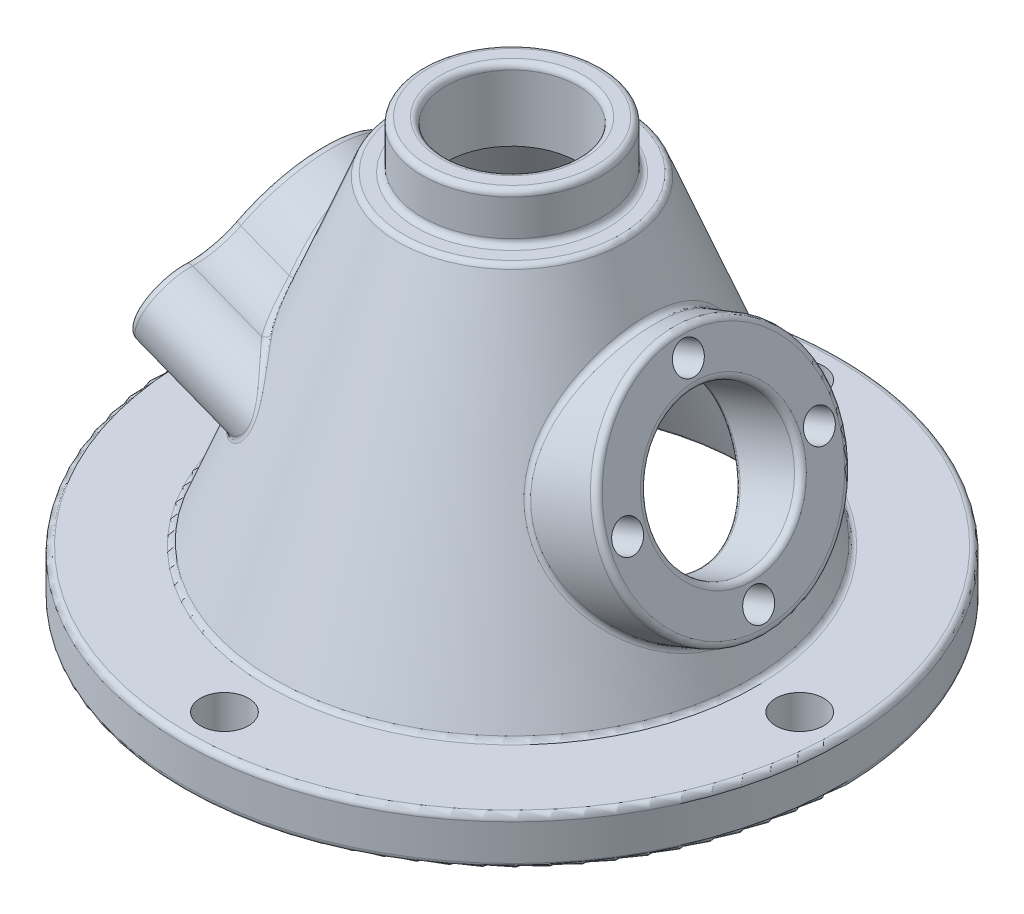
from build123d import *

# Parameters (mm, degrees)
SKETCH1_R                  = 27.499999999999996
SKETCH1_R_2                = 20
SKETCH1_R_3                = 2.0000000000000004
BOSS_EXTRUDE1_DEPTH        = 4
BOSS_EXTRUDE2_REACH        = 64.546
SKETCH9_R                  = 1.2499999999999991
SKETCH9_R_2                = 7.000000000000002
CUT_EXTRUDE1_REACH         = 64.546
SKETCH9_2_R                = 7.000000000000002
SKETCH9_2_R_2              = 1.2499999999999991
BOSS_EXTRUDE3_REACH        = 63.977
SKETCH10_R                 = 10
SKETCH10_R_2               = 6
F_2_5MM_DOWEL_HOLE1_REACH  = 63.977
F_2_5MM_DOWEL_HOLE1_BORE_R = 1.25
CUT_EXTRUDE2_REACH         = 63.977
FILLET1_R                  = 0.5


# Read off the part's stored shape, not the designer's step: Revolve1
with BuildPart() as part:
    # Sketch1 → Boss-Extrude1 (new body)
    with BuildSketch(Plane(origin=(0, 0, 0), x_dir=(1, 0, 0), z_dir=(0, 1, 0))):
        with Locations(Location((0, 0, 0), (0, 0, 270))):
            Circle(SKETCH1_R)
        with Locations(Location((0, 0, 0), (0, 0, 270))):
            Circle(SKETCH1_R_2, mode=Mode.SUBTRACT)
        with Locations(Location((0, 24.000000000000004, 0), (0, 0, 270))):
            Circle(SKETCH1_R_3, mode=Mode.SUBTRACT)
        with Locations(Location((24.000000000000004, -8.38e-14, 0), (0, 0, 270))):
            Circle(SKETCH1_R_3, mode=Mode.SUBTRACT)
        with Locations(Location((-1.6759e-13, -24.000000000000004, 0), (0, 0, 270))):
            Circle(SKETCH1_R_3, mode=Mode.SUBTRACT)
        with Locations(Location((-24, 2.5139e-13, 0), (0, 0, 270))):
            Circle(SKETCH1_R_3, mode=Mode.SUBTRACT)
    extrude(amount=BOSS_EXTRUDE1_DEPTH)

    # Revolve1 outline → Revolve1 (revolve)
    with BuildSketch(Plane.XY):
        Polygon((7.5, 35), (5.5, 35), (5.5, 29), (8.002665629, 29), (19.426069421, 0), (20, 0), (20, 4), (9.364417158, 31), (7.5, 31), align=None)
    revolve(axis=Axis((0, 0, 0), (0, 1, 0)))

    # Sketch9 → Boss-Extrude2 (add, up to next)
    with BuildSketch(Plane(origin=(-22.09393297288762, 8.614064510607436, 0), x_dir=(0.3632512304729791, 0.9316912275855487, 0), z_dir=(0.9316912275855487, -0.3632512304729791, 0)), mode=Mode.PRIVATE) as boss_extrude2_sk1:
        with BuildLine():
            ThreePointArc((14.77259875022217, -6.38125), (17.94769994946997, 0), (14.77259875022217, 6.38125))
            ThreePointArc((14.77259875022217, 6.38125), (13.552789514195275, 7.896554971385807), (13.192028453424037, 9.808081896551725))
            ThreePointArc((13.192028453424037, 9.808081896551725), (9.94769994946997, 13.25), (6.703371445515905, 9.808081896551725))
            ThreePointArc((6.703371445515905, 9.808081896551725), (6.342610384744666, 7.896554971385807), (5.122801148717772, 6.38125))
            ThreePointArc((5.122801148717772, 6.38125), (1.9476999494699712, 9.8e-16), (5.122801148717772, -6.38125))
            ThreePointArc((5.122801148717772, -6.38125), (6.342610384744666, -7.896554971385807), (6.703371445515905, -9.808081896551725))
            ThreePointArc((6.703371445515905, -9.808081896551725), (9.947699949469971, -13.250000000000002), (13.192028453424037, -9.808081896551725))
            ThreePointArc((13.192028453424037, -9.808081896551725), (13.552789514195275, -7.896554971385807), (14.77259875022217, -6.38125))
        make_face()
        with Locations(Location((9.947699949469971, -10, 0), (0, 0, 208.325415901))):
            Circle(SKETCH9_R, mode=Mode.SUBTRACT)
        with Locations(Location((9.94769994946997, 10, 0), (0, 0, 224.865925471))):
            Circle(SKETCH9_R, mode=Mode.SUBTRACT)
        with Locations(Location((9.947699949469971, 0, 0), (0, 0, 200.611127759))):
            Circle(SKETCH9_R_2, mode=Mode.SUBTRACT)
    boss_extrude2_tool1 = extrude(boss_extrude2_sk1.sketch, amount=BOSS_EXTRUDE2_REACH, mode=Mode.PRIVATE) - part.part
    add(boss_extrude2_tool1.solids().sort_by_distance((-18.480419, 17.882249, -12.940444))[0])

    # Sketch9<2> → Cut-Extrude1 (cut, up to next)
    with BuildSketch(Plane(origin=(-22.09393297288762, 8.614064510607436, 0), x_dir=(0.3632512304729791, 0.9316912275855487, 0), z_dir=(0.9316912275855487, -0.3632512304729791, 0)), mode=Mode.PRIVATE) as cut_extrude1_sk1:
        with Locations(Location((9.947699949469971, 0, 0), (0, 0, 189.221872135))):
            Circle(SKETCH9_2_R)
    cut_extrude1_tool1 = extrude(cut_extrude1_sk1.sketch, amount=CUT_EXTRUDE1_REACH, mode=Mode.PRIVATE) & part.part
    # Sketch9<2> → Cut-Extrude1 (cut, up to next)
    with BuildSketch(Plane(origin=(-22.09393297288762, 8.614064510607436, 0), x_dir=(0.3632512304729791, 0.9316912275855487, 0), z_dir=(0.9316912275855487, -0.3632512304729791, 0)), mode=Mode.PRIVATE) as cut_extrude1_sk2:
        with Locations(Location((9.947699949469971, -10, 0), (0, 0, 194.288456843))):
            Circle(SKETCH9_2_R_2)
    cut_extrude1_tool2 = extrude(cut_extrude1_sk2.sketch, amount=CUT_EXTRUDE1_REACH, mode=Mode.PRIVATE) & part.part
    # Sketch9<2> → Cut-Extrude1 (cut, up to next)
    with BuildSketch(Plane(origin=(-22.09393297288762, 8.614064510607436, 0), x_dir=(0.3632512304729791, 0.9316912275855487, 0), z_dir=(0.9316912275855487, -0.3632512304729791, 0)), mode=Mode.PRIVATE) as cut_extrude1_sk3:
        with Locations(Location((9.94769994946997, 10, 0), (0, 0, 227.545772994))):
            Circle(SKETCH9_2_R_2)
    cut_extrude1_tool3 = extrude(cut_extrude1_sk3.sketch, amount=CUT_EXTRUDE1_REACH, mode=Mode.PRIVATE) & part.part
    add(cut_extrude1_tool1.solids().sort_by_distance((-18.480419, 17.882249, 0))[0], mode=Mode.SUBTRACT)
    add(cut_extrude1_tool2.solids().sort_by_distance((-18.480419, 17.882249, -10))[0], mode=Mode.SUBTRACT)
    add(cut_extrude1_tool3.solids().sort_by_distance((-18.480419, 17.882249, 10))[0], mode=Mode.SUBTRACT)

    # Sketch10 → Boss-Extrude3 (add, up to next)
    with BuildSketch(Plane(origin=(21.239146980913837, 8.36632248890728, 0), x_dir=(0.36650122672429136, -0.9304175679820269, 0), z_dir=(-0.9304175679820269, -0.36650122672429136, 0)), mode=Mode.PRIVATE) as boss_extrude3_sk1:
        with Locations(Location((-9.81585567893876, -2.43e-15, 0), (0, 0, 301.3729923))):
            Circle(SKETCH10_R)
        with Locations(Location((-9.81585567893876, -2.43e-15, 0), (0, 0, 333.127229573))):
            Circle(SKETCH10_R_2, mode=Mode.SUBTRACT)
    boss_extrude3_tool1 = extrude(boss_extrude3_sk1.sketch, amount=BOSS_EXTRUDE3_REACH, mode=Mode.PRIVATE) - part.part
    add(boss_extrude3_tool1.solids().sort_by_distance((15.787559, 22.205984, 8.296473))[0])

    # Ø2.5mm Dowel Hole1 bore → Ø2.5mm Dowel Hole1 (cut, up to next)
    with BuildSketch(Plane(origin=(21.23914698091384, 8.366322488907281, 0), x_dir=(0, 0, -1), z_dir=(0.9304175679820269, 0.3665012267242914, 0)), mode=Mode.PRIVATE) as f_2_5mm_dowel_hole1_sk1:
        with Locations((-8, 9.815855679)):
            Circle(F_2_5MM_DOWEL_HOLE1_BORE_R)
    f_2_5mm_dowel_hole1_tool1 = extrude(f_2_5mm_dowel_hole1_sk1.sketch, amount=-F_2_5MM_DOWEL_HOLE1_REACH, mode=Mode.PRIVATE) & part.part
    # Ø2.5mm Dowel Hole1 bore → Ø2.5mm Dowel Hole1 (cut, up to next)
    with BuildSketch(Plane(origin=(21.23914698091384, 8.366322488907281, 0), x_dir=(0, 0, -1), z_dir=(0.9304175679820269, 0.3665012267242914, 0)), mode=Mode.PRIVATE) as f_2_5mm_dowel_hole1_sk2:
        with Locations((0, 17.815855679)):
            Circle(F_2_5MM_DOWEL_HOLE1_BORE_R)
    f_2_5mm_dowel_hole1_tool2 = extrude(f_2_5mm_dowel_hole1_sk2.sketch, amount=-F_2_5MM_DOWEL_HOLE1_REACH, mode=Mode.PRIVATE) & part.part
    # Ø2.5mm Dowel Hole1 bore → Ø2.5mm Dowel Hole1 (cut, up to next)
    with BuildSketch(Plane(origin=(21.23914698091384, 8.366322488907281, 0), x_dir=(0, 0, -1), z_dir=(0.9304175679820269, 0.3665012267242914, 0)), mode=Mode.PRIVATE) as f_2_5mm_dowel_hole1_sk3:
        with Locations((8, 9.815855679)):
            Circle(F_2_5MM_DOWEL_HOLE1_BORE_R)
    f_2_5mm_dowel_hole1_tool3 = extrude(f_2_5mm_dowel_hole1_sk3.sketch, amount=-F_2_5MM_DOWEL_HOLE1_REACH, mode=Mode.PRIVATE) & part.part
    # Ø2.5mm Dowel Hole1 bore → Ø2.5mm Dowel Hole1 (cut, up to next)
    with BuildSketch(Plane(origin=(21.23914698091384, 8.366322488907281, 0), x_dir=(0, 0, -1), z_dir=(0.9304175679820269, 0.3665012267242914, 0)), mode=Mode.PRIVATE) as f_2_5mm_dowel_hole1_sk4:
        with Locations((0, 1.815855679)):
            Circle(F_2_5MM_DOWEL_HOLE1_BORE_R)
    f_2_5mm_dowel_hole1_tool4 = extrude(f_2_5mm_dowel_hole1_sk4.sketch, amount=-F_2_5MM_DOWEL_HOLE1_REACH, mode=Mode.PRIVATE) & part.part
    add(f_2_5mm_dowel_hole1_tool1.solids().sort_by_distance((17.641624, 17.499167, 8))[0], mode=Mode.SUBTRACT)
    add(f_2_5mm_dowel_hole1_tool2.solids().sort_by_distance((14.709614, 24.942508, 0))[0], mode=Mode.SUBTRACT)
    add(f_2_5mm_dowel_hole1_tool3.solids().sort_by_distance((17.641624, 17.499167, -8))[0], mode=Mode.SUBTRACT)
    add(f_2_5mm_dowel_hole1_tool4.solids().sort_by_distance((20.573634, 10.055827, 0))[0], mode=Mode.SUBTRACT)

    # Sketch10<2> → Cut-Extrude2 (cut, up to next)
    with BuildSketch(Plane(origin=(21.239146980913837, 8.36632248890728, 0), x_dir=(0.36650122672429136, -0.9304175679820269, 0), z_dir=(-0.9304175679820269, -0.36650122672429136, 0)), mode=Mode.PRIVATE) as cut_extrude2_sk1:
        with BuildLine():
            ThreePointArc((-15.81585567893876, -1.69e-15), (-9.815855678938762, -6.000000000000003), (-3.8158556789387603, -3.9e-15))
            Line((-3.8158556789387603, -3.45e-15), (-15.81585567893876, -2.07e-15))
        make_face()
    cut_extrude2_tool1 = extrude(cut_extrude2_sk1.sketch, amount=CUT_EXTRUDE2_REACH, mode=Mode.PRIVATE) & part.part
    # Sketch10<2> → Cut-Extrude2 (cut, up to next)
    with BuildSketch(Plane(origin=(21.239146980913837, 8.36632248890728, 0), x_dir=(0.36650122672429136, -0.9304175679820269, 0), z_dir=(-0.9304175679820269, -0.36650122672429136, 0)), mode=Mode.PRIVATE) as cut_extrude2_sk2:
        with BuildLine():
            Line((-15.81585567893876, -2.07e-15), (-3.8158556789387603, -3.45e-15))
            ThreePointArc((-3.8158556789387603, -2.43e-15), (-9.81585567893876, 5.999999999999997), (-15.81585567893876, -1.69e-15))
        make_face()
    cut_extrude2_tool2 = extrude(cut_extrude2_sk2.sketch, amount=CUT_EXTRUDE2_REACH, mode=Mode.PRIVATE) & part.part
    # Sketch10<2> → Cut-Extrude2 (cut, up to next)
    with BuildSketch(Plane(origin=(21.239146980913837, 8.36632248890728, 0), x_dir=(0.36650122672429136, -0.9304175679820269, 0), z_dir=(-0.9304175679820269, -0.36650122672429136, 0)), mode=Mode.PRIVATE) as cut_extrude2_sk3:
        with BuildLine():
            ThreePointArc((-15.81585567893876, -1.69e-15), (-9.815855678938762, -6.000000000000003), (-3.8158556789387603, -3.9e-15))
            Line((-3.8158556789387603, -3.45e-15), (-15.81585567893876, -2.07e-15))
        make_face()
    cut_extrude2_tool3 = extrude(cut_extrude2_sk3.sketch, amount=CUT_EXTRUDE2_REACH, mode=Mode.PRIVATE) & part.part
    # Sketch10<2> → Cut-Extrude2 (cut, up to next)
    with BuildSketch(Plane(origin=(21.239146980913837, 8.36632248890728, 0), x_dir=(0.36650122672429136, -0.9304175679820269, 0), z_dir=(-0.9304175679820269, -0.36650122672429136, 0)), mode=Mode.PRIVATE) as cut_extrude2_sk4:
        with BuildLine():
            Line((-15.81585567893876, -2.07e-15), (-3.8158556789387603, -3.45e-15))
            ThreePointArc((-3.8158556789387603, -2.43e-15), (-9.81585567893876, 5.999999999999997), (-15.81585567893876, -1.69e-15))
        make_face()
    cut_extrude2_tool4 = extrude(cut_extrude2_sk4.sketch, amount=CUT_EXTRUDE2_REACH, mode=Mode.PRIVATE) & part.part
    add(cut_extrude2_tool1.solids().sort_by_distance((17.641624, 17.499167, -2.546479))[0], mode=Mode.SUBTRACT)
    add(cut_extrude2_tool2.solids().sort_by_distance((17.641624, 17.499167, 2.546479))[0], mode=Mode.SUBTRACT)
    add(cut_extrude2_tool3.solids().sort_by_distance((17.641624, 17.499167, -2.546479))[0], mode=Mode.SUBTRACT)
    add(cut_extrude2_tool4.solids().sort_by_distance((17.641624, 17.499167, 2.546479))[0], mode=Mode.SUBTRACT)

    # Fillet1
    fillet1_edges = [part.edges().sort_by_distance(p)[0] for p in [
        (11.98956557257492, 15.280109847030914, 5.999996121478412),
        (8.42e-15, 0, -27.499999999999996),
        (-5.5, 35, -3.12e-15),
        (-7.5, 35, -4.25e-15),
        (-7.5, 31, -4.25e-15),
        (-9.364417158, 31, -1.15e-15),
        (-19.426069421, 0, -2.38e-15),
        (-8.002665629, 29, -9.8e-16),
        (-8.993376824176961, 14.120545007808767, 13.249472244987173),
        (-14.605594930884681, 12.53634499701055, 7.967505831616576),
        (-17.98937680938552, 9.104264331499346, 1.4346917e-10),
        (-14.605594935197324, 12.536344992223201, -7.967505835860395),
        (-8.9933768241428, 14.120545007804564, -13.249472244917625),
        (-11.590581233598023, 19.01418510953227, -8.004181817319694),
        (-12.125321456103714, 23.99103611391226, -7.010282e-11),
        (-11.590581234697106, 19.01418511206216, 8.004181821093672),
        (-19.789971946218426, 14.523418966067045, 7.896554971385807),
        (-21.386428569650494, 10.428719467497423, -4.4e-16),
        (-19.789971946218426, 14.523418966067045, -7.8965549713858065),
        (-18.480418725866663, 17.882249288181814, -13.250000000000002),
        (-17.1708655055149, 21.241079610296584, -7.896554971385807),
        (-18.480418725866663, 17.882249288181814, 13.25),
        (-15.57440888208283, 25.335779108866205, 6.7e-16),
        (-17.1708655055149, 21.241079610296584, 7.896554971385807),
        (8.42e-15, 4, -27.499999999999996),
        (-20.000000000000014, 4, -1.044e-14),
        (-10.610354110525334, 22.230109822447105, 1.120893752968703),
        (11.91239091843123, 15.28876454985522, 9.999906803983942),
        (15.680081897776029, 22.478831364076267, 2.7120650117457057),
        (15.733591938141085, 22.342988212706608, 8.53796292463267),
    ]]
    fillet(fillet1_edges, radius=FILLET1_R)


solid = part.part
